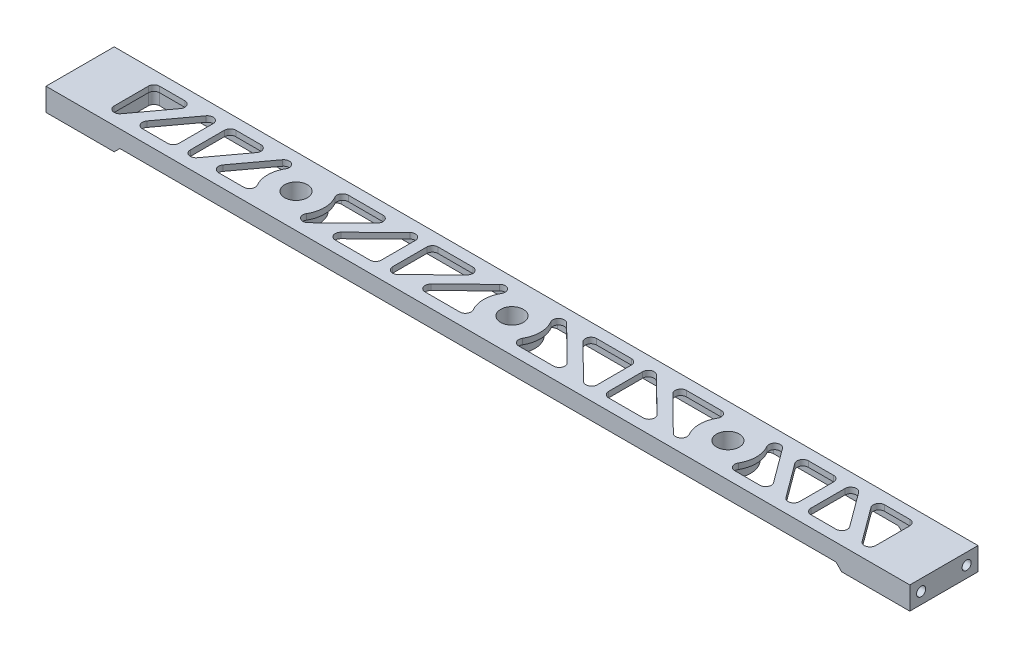
from build123d import *

# Parameters (mm, degrees)
SKETCH1_W                        = 38.1
SKETCH1_H                        = 12.7
BOSS_EXTRUDE1_DEPTH              = 241.3
F_1_4_20_TAPPED_HOLE1_AT_2_COUNT = 2
F_1_4_20_TAPPED_HOLE1_AT_2_PITCH = 25.4
SKETCH2_R                        = 6.35
CUT_EXTRUDE1_DEPTH               = 243.383750487
CUT_EXTRUDE2_DEPTH               = 9.525
CUT_EXTRUDE3_DEPTH               = 243.238143415
CUT_EXTRUDE4_DEPTH               = 245.371893842


with BuildPart() as part:
    # Sketch1 → Boss-Extrude1 (new, symmetric)
    with BuildSketch(Plane(origin=(0, 0, 0), x_dir=(0, 0, -1), z_dir=(1, 0, 0))):
        Rectangle(SKETCH1_W, SKETCH1_H)
    extrude(amount=BOSS_EXTRUDE1_DEPTH, both=True)

    # Sketch3 → 1/4-20 Tapped Hole1 (revolve, cut)
    with BuildSketch(Plane(origin=(241.3, 0, 12.7), x_dir=(0, 0, -1), z_dir=(0, 1, 0))):
        Polygon((0, 0), (0, 20.583816902), (2.5527, 19.05), (2.5527, 0), align=None)
    f_1_4_20_tapped_hole1 = revolve(axis=Axis((247.65, 0, 12.7), (-1, 0, 0)), mode=Mode.SUBTRACT)

    # 1/4-20 Tapped Hole1 at 2: 1/4-20 Tapped Hole1 ×2
    with Locations(*[(0, 0, -i * F_1_4_20_TAPPED_HOLE1_AT_2_PITCH) for i in range(1, F_1_4_20_TAPPED_HOLE1_AT_2_COUNT)]):
        add(f_1_4_20_tapped_hole1, mode=Mode.SUBTRACT)

    # Sketch2 → Cut-Extrude1 (cut, through all)
    with BuildSketch(Plane(origin=(0, 6.35, 0), x_dir=(1, 0, 0), z_dir=(0, 1, 0))):
        Circle(SKETCH2_R)
        with Locations((120.65, 0)):
            Circle(SKETCH2_R)
    cut_extrude1 = extrude(amount=-CUT_EXTRUDE1_DEPTH, mode=Mode.SUBTRACT)

    # Sketch4 → Cut-Extrude2 (cut)
    with BuildSketch(Plane.XZ.offset(6.35)):
        with BuildLine():
            Line((9.525, 15.875), (111.125, 15.875))
            ThreePointArc((111.125, 15.875), (114.137069471, 13.704023157), (113.03, 10.16))
            ThreePointArc((113.03, 10.16), (107.95, 0), (113.03, -10.16))
            ThreePointArc((113.03, -10.16), (114.137069471, -13.704023157), (111.125, -15.875))
            Line((111.125, -15.875), (9.525, -15.875))
            ThreePointArc((9.525, -15.875), (6.512930529, -13.704023157), (7.62, -10.16))
            ThreePointArc((7.62, -10.16), (12.7, 0), (7.62, 10.16))
            ThreePointArc((7.62, 10.16), (6.512930529, 13.704023157), (9.525, 15.875))
        make_face()
        with BuildLine():
            Line((130.175, 15.875), (212.725, 15.875))
            ThreePointArc((212.725, 15.875), (214.97006403, 14.94506403), (215.9, 12.7))
            Line((215.9, 12.7), (215.9, -12.7))
            ThreePointArc((215.9, -12.7), (214.97006403, -14.94506403), (212.725, -15.875))
            Line((212.725, -15.875), (130.175, -15.875))
            ThreePointArc((130.175, -15.875), (127.162930529, -13.704023157), (128.27, -10.16))
            ThreePointArc((128.27, -10.16), (133.35, 0), (128.27, 10.16))
            ThreePointArc((128.27, 10.16), (127.162930529, 13.704023157), (130.175, 15.875))
        make_face()
    cut_extrude2 = extrude(amount=-CUT_EXTRUDE2_DEPTH, mode=Mode.SUBTRACT)

    # Mirror2: 1/4-20 Tapped Hole1, Cut-Extrude1, Cut-Extrude2 across plane
    add(f_1_4_20_tapped_hole1.mirror(Plane(origin=(0, 0, 0), x_dir=(0, 0, 1), z_dir=(1, 0, 0))), mode=Mode.SUBTRACT)
    add(cut_extrude1.mirror(Plane(origin=(0, 0, 0), x_dir=(0, 0, 1), z_dir=(1, 0, 0))), mode=Mode.SUBTRACT)
    add(cut_extrude2.mirror(Plane(origin=(0, 0, 0), x_dir=(0, 0, 1), z_dir=(1, 0, 0))), mode=Mode.SUBTRACT)

    # Mirror2 copy 1 sketch → Mirror2 copy 1 (revolve, cut)
    with BuildSketch(Plane(origin=(-241.3, 0, -12.7), x_dir=(0, 0, -1), z_dir=(0, 1, 0))):
        Polygon((0, 0), (0, -20.583816902), (2.5527, -19.05), (2.5527, 0), align=None)
    revolve(axis=Axis((-247.65, 0, -12.7), (-1, 0, 0)), mode=Mode.SUBTRACT)

    # Sketch5 → Cut-Extrude3 (cut, through all)
    with BuildSketch(Plane.XZ.offset(-3.175)):
        with BuildLine():
            Line((-212.725, 9.525), (-212.725, -9.525))
            ThreePointArc((-212.725, -9.525), (-211.79506403, -11.77006403), (-209.55, -12.7))
            Line((-209.55, -12.7), (-195.485242114, -12.7))
            ThreePointArc((-195.485242114, -12.7), (-192.650798466, -10.955578277), (-192.930978485, -7.639168005))
            Line((-192.930978485, -7.639168005), (-206.995736371, 11.410831995))
            ThreePointArc((-206.995736371, 11.410831995), (-210.542682723, 12.540825925), (-212.725, 9.525))
        make_face()
        with BuildLine():
            Line((-193.763649857, 12.7), (-179.698891971, 12.7))
            ThreePointArc((-179.698891971, 12.7), (-177.453827941, 11.77006403), (-176.523891971, 9.525))
            Line((-176.523891971, 9.525), (-176.523891971, -9.525))
            ThreePointArc((-176.523891971, -9.525), (-178.706209248, -12.540825925), (-182.2531556, -11.410831995))
            Line((-182.2531556, -11.410831995), (-196.317913486, 7.639168005))
            ThreePointArc((-196.317913486, 7.639168005), (-196.598093505, 10.955578277), (-193.763649857, 12.7))
        make_face()
        with BuildLine():
            Line((-170.173891971, 9.525), (-170.173891971, -9.525))
            ThreePointArc((-170.173891971, -9.525), (-169.243956001, -11.77006403), (-166.998891971, -12.7))
            Line((-166.998891971, -12.7), (-152.934134085, -12.7))
            ThreePointArc((-152.934134085, -12.7), (-150.099690437, -10.955578277), (-150.379870456, -7.639168005))
            Line((-150.379870456, -7.639168005), (-164.444628342, 11.410831995))
            ThreePointArc((-164.444628342, 11.410831995), (-167.991574695, 12.540825925), (-170.173891971, 9.525))
        make_face()
        with BuildLine():
            Line((-151.212541828, 12.7), (-137.147783942, 12.7))
            ThreePointArc((-137.147783942, 12.7), (-134.398153285, 11.1125), (-134.398153285, 7.9375))
            ThreePointArc((-134.398153285, 7.9375), (-136.525, 0), (-134.398153285, -7.9375))
            ThreePointArc((-134.398153285, -7.9375), (-135.408372876, -12.181138954), (-139.702047571, -11.410831995))
            Line((-139.702047571, -11.410831995), (-153.766805457, 7.639168005))
            ThreePointArc((-153.766805457, 7.639168005), (-154.046985476, 10.955578277), (-151.212541828, 12.7))
        make_face()
        with BuildLine():
            Line((-104.152216058, -12.7), (-84.785451907, -12.7))
            ThreePointArc((-84.785451907, -12.7), (-81.847150244, -10.727916595), (-82.558975163, -7.261501313))
            Line((-82.558975163, -7.261501313), (-101.925739314, 11.788498687))
            ThreePointArc((-101.925739314, 11.788498687), (-106.095401645, 12.035907161), (-106.901846715, 7.9375))
            ThreePointArc((-106.901846715, 7.9375), (-104.775, 0), (-106.901846715, -7.9375))
            ThreePointArc((-106.901846715, -7.9375), (-106.901846715, -11.1125), (-104.152216058, -12.7))
        make_face()
        with BuildLine():
            Line((-86.04176415, 12.7), (-66.675, 12.7))
            ThreePointArc((-66.675, 12.7), (-64.42993597, 11.77006403), (-63.5, 9.525))
            Line((-63.5, 9.525), (-63.5, -9.525))
            ThreePointArc((-63.5, -9.525), (-65.44789745, -12.453283513), (-68.901476744, -11.788498687))
            Line((-68.901476744, -11.788498687), (-88.268240895, 7.261501313))
            ThreePointArc((-88.268240895, 7.261501313), (-88.980065814, 10.727916595), (-86.04176415, 12.7))
        make_face()
        with BuildLine():
            Line((-57.15, 9.525), (-57.15, -9.525))
            ThreePointArc((-57.15, -9.525), (-56.22006403, -11.77006403), (-53.975, -12.7))
            Line((-53.975, -12.7), (-34.60823585, -12.7))
            ThreePointArc((-34.60823585, -12.7), (-31.669934186, -10.727916595), (-32.381759105, -7.261501313))
            Line((-32.381759105, -7.261501313), (-51.748523256, 11.788498687))
            ThreePointArc((-51.748523256, 11.788498687), (-55.20210255, 12.453283513), (-57.15, 9.525))
        make_face()
        with BuildLine():
            Line((-38.091024837, 7.261501313), (-18.724260686, -11.788498687))
            ThreePointArc((-18.724260686, -11.788498687), (-14.554598355, -12.035907161), (-13.748153285, -7.9375))
            ThreePointArc((-13.748153285, -7.9375), (-15.875, 0), (-13.748153285, 7.9375))
            ThreePointArc((-13.748153285, 7.9375), (-13.748153285, 11.1125), (-16.497783942, 12.7))
            Line((-16.497783942, 12.7), (-35.864548093, 12.7))
            ThreePointArc((-35.864548093, 12.7), (-38.802849756, 10.727916595), (-38.091024837, 7.261501313))
        make_face()
    cut_extrude3 = extrude(amount=-CUT_EXTRUDE3_DEPTH, mode=Mode.SUBTRACT)

    # Mirror3: Cut-Extrude3 across plane
    add(cut_extrude3.mirror(Plane(origin=(0, 0, 0), x_dir=(0, 0, 1), z_dir=(1, 0, 0))), mode=Mode.SUBTRACT)

    # Sketch6 → Cut-Extrude4 (cut, through all)
    with BuildSketch(Plane(origin=(0, 0, -19.05), x_dir=(-1, 0, 0), z_dir=(0, 0, -1))):
        Polygon((-200.025, -3.175), (200.025, -3.175), (203.2, -6.35), (-203.2, -6.35), align=None)
    extrude(amount=-CUT_EXTRUDE4_DEPTH, mode=Mode.SUBTRACT)


solid = part.part
